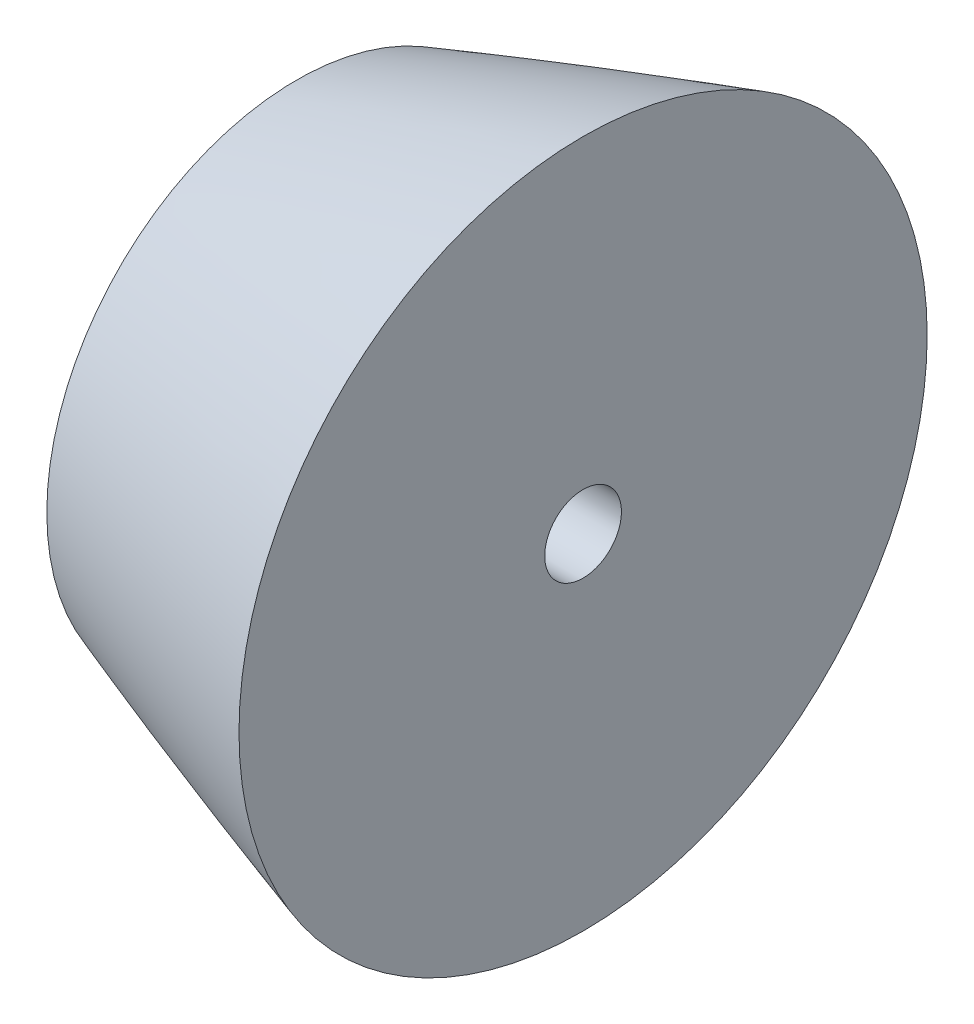
from build123d import *

# Parameters (mm, degrees)
SKETCH4_R               = 88.899999981
CUT_EXTRUDE2_DEPTH      = 435.56054822
SKETCH2_R               = 88.899999981
CUT_EXTRUDE3_DEPTH      = 48.57150611
F_1_4_20_TAPPED_HOLE1_D = 5.1054


with BuildPart() as part:
    # Sketch1 → Revolve3 (revolve)
    with BuildSketch(Plane.XY):
        with BuildLine():
            Line((0, 0), (457.2, 0))
            Line((457.2, 0), (469.892993422, 0))
            Line((469.892993422, 0), (469.892993422, 88.899999981))
            Line((469.892993422, 88.899999981), (457.2, 88.899999981))
            add(Edge.make_bspline(
                [(0, 0), (0.002252326, 0.011676015), (0.008172498, 0.034601551), (0.025924078, 0.07868817), (0.069515821, 0.163009702), (0.133891919, 0.263104421), (0.219083202, 0.377874193), (0.336980112, 0.520691984), (0.508294819, 0.709916231), (0.796743276, 0.996314892), (1.297392915, 1.436984627), (2.171427967, 2.115548405), (3.700669892, 3.156129635), (6.415913097, 4.768274854), (11.136159186, 7.198190988), (18.882543075, 10.659186), (32.161816521, 15.828571543), (51.229171373, 22.241878784), (75.23036556, 29.337949289), (102.988289697, 36.657803249), (131.619753695, 43.511950241), (160.374510852, 49.827259848), (189.22769389, 55.674239309), (218.163982111, 61.094544577), (247.172465418, 66.113329232), (276.245797951, 70.741694957), (305.378606257, 74.979662903), (334.567274001, 78.814730666), (363.809388761, 82.21995637), (389.441934274, 84.779668607), (411.445236254, 86.618046199), (428.63351735, 87.774473661), (439.738528717, 88.370701031), (448.426307528, 88.718662985), (453.439289178, 88.851920429), (455.946335944, 88.89446062), (457.2, 88.899999981)],
                knots=[0, 0, 0, 0, 0, 0.000101175, 0.000202351, 0.000404702, 0.000809403, 0.00111569, 0.001421978, 0.001985248, 0.002987861, 0.004583917, 0.007112661, 0.011425968, 0.018769715, 0.031526477, 0.052412239, 0.083827717, 0.14038342, 0.203214574, 0.266045748, 0.328876912, 0.391708076, 0.454539237, 0.517370407, 0.580201572, 0.643032736, 0.705863901, 0.768695068, 0.831526236, 0.894357403, 0.925772984, 0.957188566, 0.978594283, 0.989297141, 1, 1, 1, 1, 1], degree=4))
        make_face()
    revolve(axis=Axis((0, 0, 0), (1, 0, 0)))

    # Sketch4 → Cut-Extrude2 (cut, through all)
    with BuildSketch(Plane(origin=(53.916491633, 0, 0), x_dir=(0, 0, -1), z_dir=(1, 0, 0))):
        Circle(SKETCH4_R)
    extrude(amount=CUT_EXTRUDE2_DEPTH, mode=Mode.SUBTRACT)

    # Sketch2 → Cut-Extrude3 (cut, through all)
    with BuildSketch(Plane(origin=(34.866491633, 0, 0), x_dir=(0, 0, -1), z_dir=(1, 0, 0))):
        Circle(SKETCH2_R)
    extrude(amount=-CUT_EXTRUDE3_DEPTH, mode=Mode.SUBTRACT)

    # 1/4-20 Tapped Hole1 (through all)
    with Locations(Plane(origin=(53.916491633, 0, 0), x_dir=(0, 0, -1), z_dir=(1, 0, 0))):
        with Locations((0, 0)):
            Hole(F_1_4_20_TAPPED_HOLE1_D / 2)


solid = part.part
